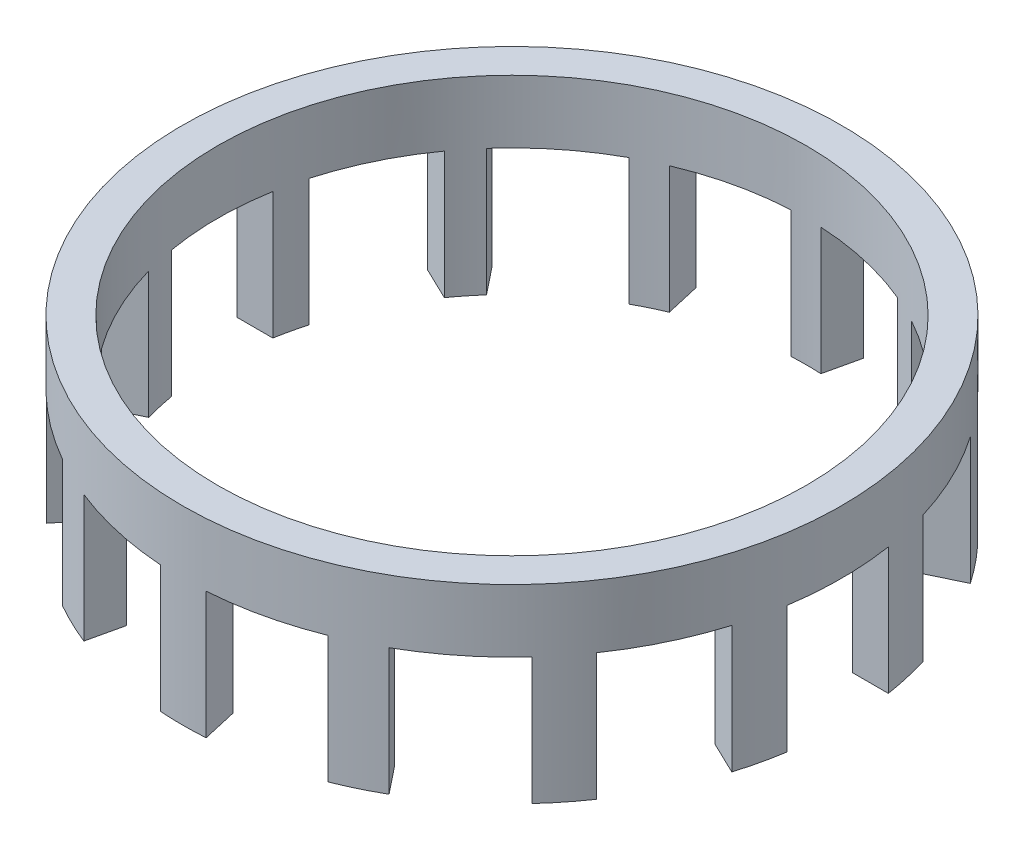
from build123d import *

# Parameters (mm, degrees)
SKETCH1_W          = 2.5
SKETCH1_H          = 13.462
CUT_EXTRUDE1_DEPTH = 9
CIRPATTERN1_COUNT  = 14


with BuildPart() as part:
    # Sketch1 → Revolve1 (revolve)
    with BuildSketch(Plane(origin=(0, 0, 0), x_dir=(0, 0, -1), z_dir=(1, 0, 0))):
        with Locations((-1.25, 6.731)):
            Rectangle(SKETCH1_W, SKETCH1_H)
    revolve(axis=Axis((0, 20.583255591, 23.368), (0, -1, 0)))

    # Sketch2 → Cut-Extrude1 (cut)
    with BuildSketch(Plane.XZ):
        with BuildLine():
            ThreePointArc((-20.55513133, 19.768), (-20.868, 23.368), (-20.55513133, 26.968))
            Line((-20.55513133, 26.968), (-23.089032548, 26.968))
            ThreePointArc((-23.089032548, 26.968), (-23.368, 23.368), (-23.089032548, 19.768))
            Line((-23.089032548, 19.768), (-20.55513133, 19.768))
        make_face()
    cut_extrude1 = extrude(amount=-CUT_EXTRUDE1_DEPTH, mode=Mode.SUBTRACT)

    # CirPattern1: Cut-Extrude1 ×14 about axis
    cirpattern1_axis = Axis((0, 13.462, 23.368), (0, 1, 0))
    for i in range(1, CIRPATTERN1_COUNT):
        add(cut_extrude1.rotate(cirpattern1_axis, i * 360 / CIRPATTERN1_COUNT), mode=Mode.SUBTRACT)


solid = part.part
